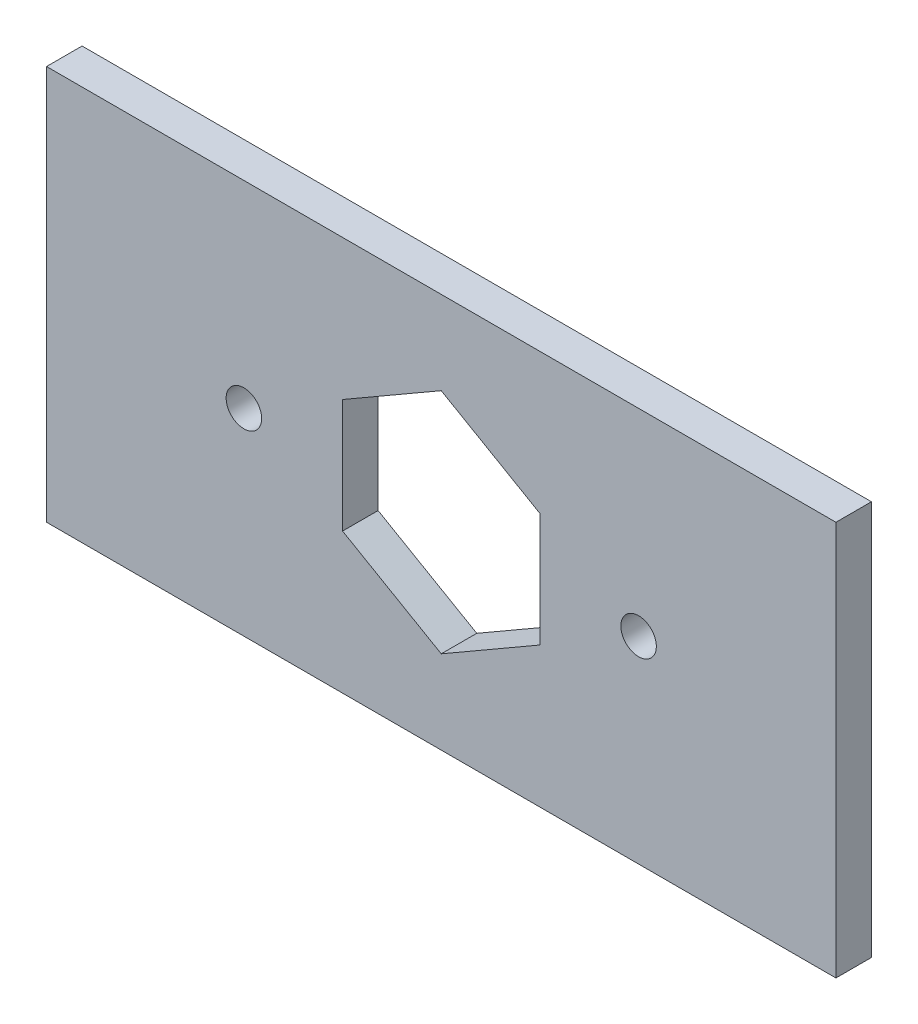
from build123d import *

# Parameters (mm, degrees)
SKETCH1_W           = 50.8
SKETCH1_H           = 25.4
SKETCH1_R           = 1.143
BOSS_EXTRUDE1_DEPTH = 1.143


with BuildPart() as part:
    # Sketch1 → Boss-Extrude1 (new, symmetric)
    with BuildSketch(Plane.XY):
        Rectangle(SKETCH1_W, SKETCH1_H)
        with Locations((-12.7, 0)):
            Circle(SKETCH1_R, mode=Mode.SUBTRACT)
        with Locations((12.7, 0)):
            Circle(SKETCH1_R, mode=Mode.SUBTRACT)
        Polygon((6.35, 3.666174209), (0, 7.332348419), (-6.35, 3.666174209), (-6.35, -3.666174209), (0, -7.332348419), (6.35, -3.666174209), align=None, mode=Mode.SUBTRACT)
    extrude(amount=BOSS_EXTRUDE1_DEPTH, both=True)


solid = part.part
